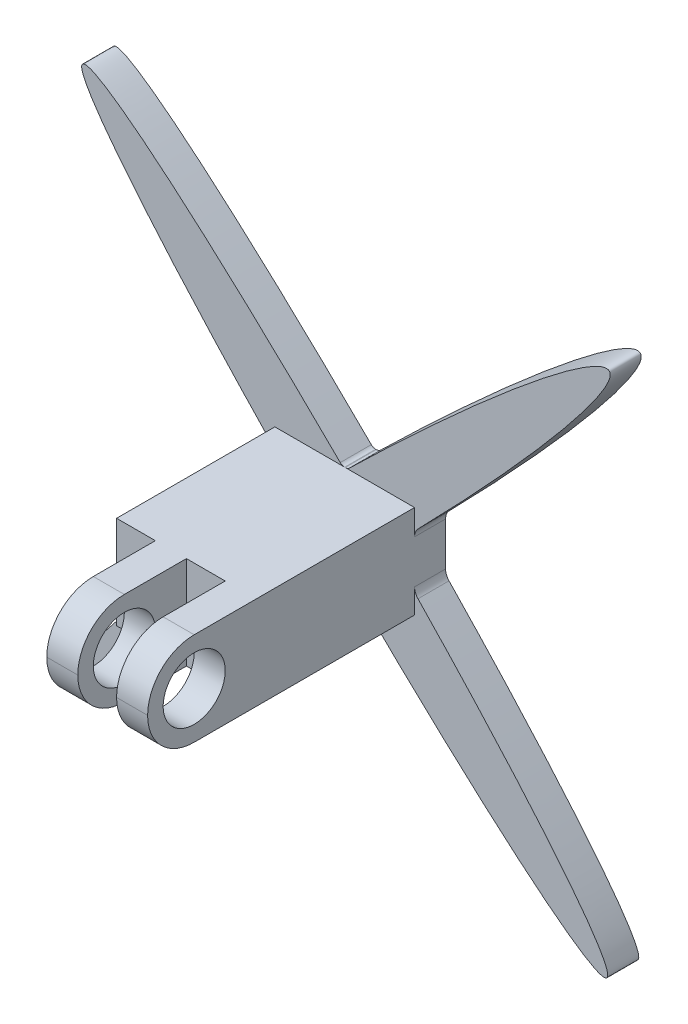
from build123d import *

# Parameters (mm, degrees)
BOSS_EXTRUDE1_DEPTH = 6.35
SKETCH2_W           = 28.575
SKETCH2_H           = 19.05
BOSS_EXTRUDE3_DEPTH = 54.61
SKETCH3_W           = 7.9375
SKETCH3_H           = 22.225
CUT_EXTRUDE1_DEPTH  = 31.75
FILLET1_R           = 9.525
SKETCH5_R           = 6.35
CUT_EXTRUDE2_DEPTH  = 31.75
FILLET2_R           = 2.54
FILLET3_R           = 1.27


with BuildPart() as part:
    # Sketch1 → Boss-Extrude1 (new body)
    with BuildSketch(Plane.XY):
        with BuildLine():
            Line((0.63279339, 9.525), (-0.536161012, 9.525))
            add(Edge.make_bspline(
                [(-0.536161012, 9.525), (-47.326176105, 56.028330045), (-53.363323714, 54.285313193), (-59.400471322, 52.54229634), (-14.2875, 5.554778108)],
                knots=[1.664695189, 1.664695189, 1.664695189, 3.096147297, 3.096147297, 4.527599405, 4.527599405, 4.527599405], degree=2, weights=[1, 0.754617028, 1, 0.754617028, 1]))
            Line((-14.2875, 5.554778108), (-14.2875, -5.364550202))
            add(Edge.make_bspline(
                [(-14.2875, -5.364550202), (-59.880168802, -51.944843344), (-53.883111421, -53.772085546), (-47.88605404, -55.599327748), (-0.63279339, -9.525)],
                knots=[4.896178708, 4.896178708, 4.896178708, 6.328078304, 6.328078304, 7.759977899, 7.759977899, 7.759977899], degree=2, weights=[1, 0.754470197, 1, 0.754470197, 1]))
            Line((-0.63279339, -9.525), (0.536161012, -9.525))
            add(Edge.make_bspline(
                [(0.536161012, -9.525), (47.326176105, -56.028330045), (53.363323714, -54.285313193), (59.400471322, -52.54229634), (14.2875, -5.554778108)],
                knots=[4.806287842, 4.806287842, 4.806287842, 6.23773995, 6.23773995, 7.669192059, 7.669192059, 7.669192059], degree=2, weights=[1, 0.754617028, 1, 0.754617028, 1]))
            Line((14.2875, -5.554778108), (14.2875, 5.364550202))
            add(Edge.make_bspline(
                [(14.2875, 5.364550202), (59.880168802, 51.944843344), (53.883111421, 53.772085546), (47.88605404, 55.599327748), (0.63279339, 9.525)],
                knots=[1.754586054, 1.754586054, 1.754586054, 3.18648565, 3.18648565, 4.618385246, 4.618385246, 4.618385246], degree=2, weights=[1, 0.754470197, 1, 0.754470197, 1]))
        make_face()
    extrude(amount=BOSS_EXTRUDE1_DEPTH)

    # Sketch2 → Boss-Extrude3 (add)
    with BuildSketch(Plane.XY.offset(6.35)):
        Rectangle(SKETCH2_W, SKETCH2_H)
    extrude(amount=BOSS_EXTRUDE3_DEPTH)

    # Sketch3 → Cut-Extrude1 (cut)
    with BuildSketch(Plane.XZ.offset(9.525)):
        with Locations((-10.31875, 49.8475)):
            Rectangle(SKETCH3_W, SKETCH3_H)
        with Locations((3.96875, 49.8475)):
            Rectangle(SKETCH3_W, SKETCH3_H)
    extrude(amount=-CUT_EXTRUDE1_DEPTH, mode=Mode.SUBTRACT)

    # Fillet1
    fillet1_edges = [part.edges().sort_by_distance(p)[0] for p in [
        (11.1125, -9.525, 60.96),
        (-3.175, -9.525, 60.96),
        (11.1125, 9.525, 60.96),
        (-3.175, 9.525, 60.96),
    ]]
    fillet(fillet1_edges, radius=FILLET1_R - 0.0001)  # a hair under: the kernel refuses the full size

    # Sketch5 → Cut-Extrude2 (cut)
    with BuildSketch(Plane.ZY.offset(6.35)):
        with Locations(Location((51.435, 0, 0), (0, 0, 270))):
            Circle(SKETCH5_R)
    extrude(amount=-CUT_EXTRUDE2_DEPTH, mode=Mode.SUBTRACT)

    # Fillet2
    fillet2_edges = [part.edges().sort_by_distance(p)[0] for p in [
        (14.2875, -5.554778108, 3.175),
        (14.2875, 5.364550202, 3.175),
        (-14.2875, -5.364550202, 3.175),
        (-14.2875, 5.554778108, 3.175),
    ]]
    fillet(fillet2_edges, radius=FILLET2_R)

    # Fillet3
    fillet3_edges = [part.edges().sort_by_distance(p)[0] for p in [
        (0.63279339, 9.525, 3.175),
        (-0.536161012, 9.525, 3.175),
        (-0.63279339, -9.525, 3.175),
        (0.536161012, -9.525, 3.175),
    ]]
    fillet(fillet3_edges, radius=FILLET3_R)


solid = part.part
